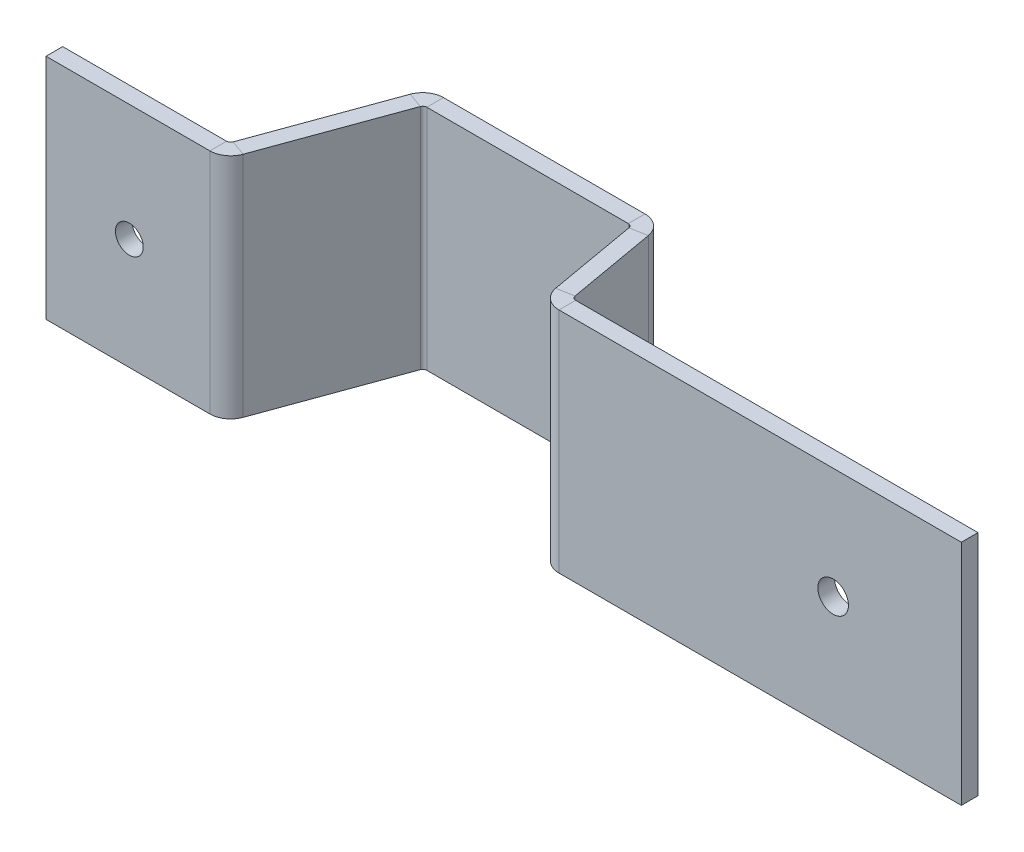
from build123d import *

# Parameters (mm, degrees)
BASE_FLANGE1_DEPTH = 41
SKETCH2_R          = 2.5
CUT_EXTRUDE1_DEPTH = 10
SKETCH3_R          = 2.75
SKETCH3_R_2        = 2.5
CUT_EXTRUDE2_DEPTH = 10


# Sheet-metal steps are written as plain solids
with BuildPart() as part:
    # Sketch1 → Base-Flange1 (new body)
    with BuildSketch(Plane(origin=(0, 0, 0), x_dir=(1, 0, 0), z_dir=(0, 1, 0))):
        with BuildLine():
            Line((0, 0), (29.484227127, 0))
            ThreePointArc((29.484227127, 0), (29.90672353, 0.133212604), (30.176404712, 0.484667962))
            Line((30.176404712, 0.484667962), (38.681704054, 23.85278585))
            ThreePointArc((38.681704054, 23.85278585), (40.049733788, 25.635636911), (42.1929595, 26.311393382))
            Line((42.1929595, 26.311393382), (78.441184331, 26.311393382))
            ThreePointArc((78.441184331, 26.311393382), (80.843024514, 25.437195048), (82.121016981, 23.223647163))
            Line((82.121016981, 23.223647163), (84.942198964, 7.223929074))
            ThreePointArc((84.942198964, 7.223929074), (85.194131001, 6.787569985), (85.667608355, 6.615238322))
            Line((85.667608355, 6.615238322), (158.049527566, 6.615238322))
            Line((158.049527566, 6.615238322), (158.049527566, 3.615238322))
            Line((158.049527566, 3.615238322), (85.667608355, 3.615238322))
            ThreePointArc((85.667608355, 3.615238322), (83.265768172, 4.489436656), (81.987775705, 6.702984541))
            Line((81.987775705, 6.702984541), (79.166593722, 22.70270263))
            ThreePointArc((79.166593722, 22.70270263), (78.914661685, 23.139061719), (78.441184331, 23.311393382))
            Line((78.441184331, 23.311393382), (42.1929595, 23.311393382))
            ThreePointArc((42.1929595, 23.311393382), (41.770463097, 23.178180778), (41.500781916, 22.82672542))
            Line((41.500781916, 22.82672542), (32.995482574, -0.541392468))
            ThreePointArc((32.995482574, -0.541392468), (31.627452839, -2.324243529), (29.484227127, -3))
            Line((29.484227127, -3), (0, -3))
            Line((0, -3), (0, 0))
        make_face()
    extrude(amount=BASE_FLANGE1_DEPTH)

    # Sketch2 → Cut-Extrude1 (cut)
    with BuildSketch(Plane.XY.offset(3)):
        with Locations((14.991664351, 20)):
            Circle(SKETCH2_R)
    extrude(amount=-CUT_EXTRUDE1_DEPTH, mode=Mode.SUBTRACT)

    # Sketch3 → Cut-Extrude2 (cut)
    with BuildSketch(Plane.XY.offset(-3.615238322)):
        with Locations((134.991664351, 21)):
            Circle(SKETCH3_R)
        with Locations((14.991664351, 20)):
            Circle(SKETCH3_R_2)
    extrude(amount=-CUT_EXTRUDE2_DEPTH, mode=Mode.SUBTRACT)


solid = part.part
